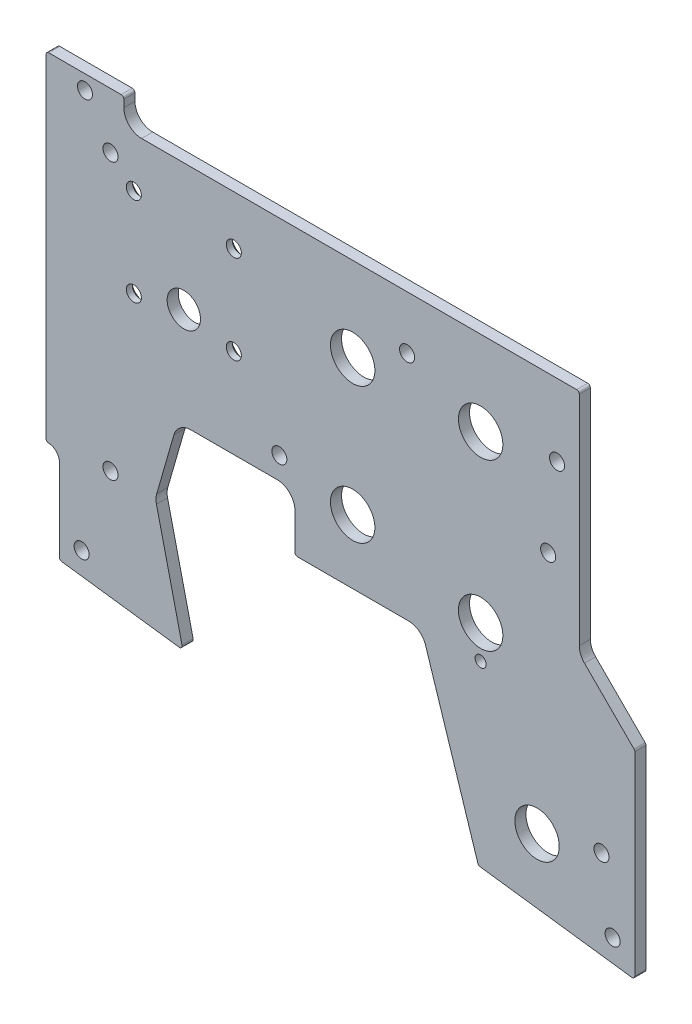
from build123d import *

# Parameters (mm, degrees)
BOSS_EXTRUDE1_DEPTH                       = 3.175
F_6_CLEARANCE_HOLE1_D                     = 4.3053
SKETCH4_R                                 = 6.35
SKETCH4_R_2                               = 1.5875
SKETCH4_R_3                               = 4.7625
CUT_EXTRUDE1_DEPTH                        = 218.405084842
CSK_FOR_6_FLAT_HEAD_MACHINE_SCREW_2_COUNT = 2
CSK_FOR_6_FLAT_HEAD_MACHINE_SCREW_2_PITCH = 28.575
CSK_FOR_6_FLAT_HEAD_MACHINE_SCREW_3_COUNT = 2
CSK_FOR_6_FLAT_HEAD_MACHINE_SCREW_3_PITCH = 38.232062788
CSK_FOR_6_FLAT_HEAD_MACHINE_SCREW_4_COUNT = 2
CSK_FOR_6_FLAT_HEAD_MACHINE_SCREW_4_PITCH = 25.4


with BuildPart() as part:
    # Sketch1 → Boss-Extrude1 (new body)
    with BuildSketch(Plane.XY):
        with BuildLine():
            Line((3.809986215, -91.884500325), (3.80998361, -115.403340545))
            ThreePointArc((3.80998361, -115.403340545), (3.999081622, -115.90576205), (4.472522544, -116.158821571))
            Line((4.472522544, -116.158821571), (38.023104274, -120.5758443))
            ThreePointArc((38.023104274, -120.5758443), (38.687459595, -120.33177166), (38.864463259, -119.646491316))
            Line((38.864463259, -119.646491316), (31.544635998, -88.413376307))
            ThreePointArc((31.544635998, -88.413376307), (31.412233483, -87.126289027), (31.609278422, -85.84750156))
            Line((31.609278422, -85.84750156), (36.533410401, -68.760772014))
            ThreePointArc((36.533410401, -68.760772014), (38.360231081, -66.108400459), (41.414754107, -65.0875))
            Line((41.414754107, -65.0875), (66.039990754, -65.0875))
            ThreePointArc((66.039990754, -65.0875), (69.632093202, -66.575397552), (71.119990754, -70.1675))
            Line((71.119990754, -70.1675), (71.119990754, -80.518))
            ThreePointArc((71.119990754, -80.518), (71.343175387, -81.056815367), (71.881990754, -81.28))
            Line((71.881990754, -81.28), (103.612235862, -81.28))
            ThreePointArc((103.612235862, -81.28), (106.604490402, -82.25478225), (108.448399818, -84.805034342))
            Line((108.448399818, -84.805034342), (123.423319929, -131.379161885))
            ThreePointArc((123.423319929, -131.379161885), (123.660593225, -131.731025839), (124.049283564, -131.901398021))
            Line((124.049283564, -131.901398021), (167.413526593, -137.610408921))
            ThreePointArc((167.413526593, -137.610408921), (168.015409063, -137.42782987), (168.274987552, -136.854927937))
            Line((168.274987552, -136.854927937), (168.274987552, -81.303553632))
            ThreePointArc((168.274987552, -81.303553632), (168.216983776, -81.011948907), (168.051802995, -80.764738341))
            Line((168.051802995, -80.764738341), (153.88788809, -66.600819412))
            ThreePointArc((153.88788809, -66.600819412), (152.786682817, -64.952748811), (152.399991049, -63.008717113))
            Line((152.399991049, -63.008717113), (152.399999892, -0.762021595))
            ThreePointArc((152.399999892, -0.762021595), (152.176815316, -0.223206231), (151.638, -2.1541e-05))
            Line((151.638, -2.1541e-05), (27.305, -3.804e-06))
            ThreePointArc((27.305, -3.804e-06), (23.712898123, 1.487894033), (22.22500087, 5.079996121))
            Line((22.22500087, 5.079996121), (22.225001755, 7.175496897))
            ThreePointArc((22.225001755, 7.175496897), (22.001816945, 7.7143128), (21.463001073, 7.937498421))
            Line((21.463001073, 7.937498421), (0.762001075, 7.937499892))
            ThreePointArc((0.762001075, 7.937499892), (0.223185691, 7.714315297), (1.021e-06, 7.175499945))
            Line((1.021e-06, 7.175499945), (-1.2342e-05, -87.949548922))
            ThreePointArc((-1.2342e-05, -87.949548922), (0.214550622, -88.479602508), (0.737406874, -88.711153328))
            ThreePointArc((0.737406874, -88.711153328), (2.915974038, -89.675944454), (3.809986215, -91.884500325))
        make_face()
    extrude(amount=-BOSS_EXTRUDE1_DEPTH)

    # #6 Clearance Hole1 (through all)
    with Locations(Plane(origin=(0, 0, -3.175), x_dir=(-1, 0, 0), z_dir=(0, 0, -1))):
        with Locations((-11.112500541, 3.81), (-18.414998872, -7.937503157), (-103.187497835, -15.240014658), (-143.510001128, -44.450020387), (-158.750001128, -111.125021649), (-18.414987678, -86.741003157), (-66.674991751, -58.7375), (-10.16, -110.502822935), (-146.049997068, -20.637520747), (-161.924987552, -130.483035149)):
            Hole(F_6_CLEARANCE_HOLE1_D / 2)

    # Sketch4 → Cut-Extrude1 (cut, through all)
    with BuildSketch(Plane(origin=(0, 0, -3.175), x_dir=(-1, 0, 0), z_dir=(0, 0, -1))):
        with Locations((-140.334987552, -115.57)):
            Circle(SKETCH4_R)
        with Locations((-124.205996572, -71.437521424)):
            Circle(SKETCH4_R)
        with Locations((-87.63, -62.992021649)):
            Circle(SKETCH4_R)
        with Locations((-87.63, -24.130021649)):
            Circle(SKETCH4_R)
        with Locations((-124.205996572, -24.130021649)):
            Circle(SKETCH4_R)
        with Locations((-124.205996572, -80.962521424)):
            Circle(SKETCH4_R_2)
        with Locations((-39.36999484, -36.322003157)):
            Circle(SKETCH4_R_3)
    extrude(amount=-CUT_EXTRUDE1_DEPTH, mode=Mode.SUBTRACT)

    # Sketch5 → CSK for #6 Flat Head Machine Screw (100)1 (revolve, cut)
    with BuildSketch(Plane(origin=(53.65749484, -14.097003157, -3.175), x_dir=(0, 1, 0), z_dir=(1, 0, 0))):
        Polygon((0, 0), (0, 3.175), (2.15265, 3.175), (2.15265, 1.420893136), (3.8460045, 0), align=None)
    csk_for_6_flat_head_machine_screw_100 = revolve(axis=Axis((53.65749484, -14.097003157, -9.525), (0, 0, 1)), mode=Mode.SUBTRACT)

    # CSK for _6 Flat Head Machine Screw _ 2: CSK for #6 Flat Head Machine Screw (100)1 ×2
    with Locations(*[(-i * CSK_FOR_6_FLAT_HEAD_MACHINE_SCREW_2_PITCH, 0, 0) for i in range(1, CSK_FOR_6_FLAT_HEAD_MACHINE_SCREW_2_COUNT)]):
        add(csk_for_6_flat_head_machine_screw_100, mode=Mode.SUBTRACT)

    # CSK for _6 Flat Head Machine Screw _ 3: CSK for #6 Flat Head Machine Screw (100)1 ×2
    with Locations(*[Vector(-0.7474093186836602, -0.6643638388299193, 0) * (i * CSK_FOR_6_FLAT_HEAD_MACHINE_SCREW_3_PITCH) for i in range(1, CSK_FOR_6_FLAT_HEAD_MACHINE_SCREW_3_COUNT)]):
        add(csk_for_6_flat_head_machine_screw_100, mode=Mode.SUBTRACT)

    # CSK for _6 Flat Head Machine Screw _ 4: CSK for #6 Flat Head Machine Screw (100)1 ×2
    with Locations(*[(0, -i * CSK_FOR_6_FLAT_HEAD_MACHINE_SCREW_4_PITCH, 0) for i in range(1, CSK_FOR_6_FLAT_HEAD_MACHINE_SCREW_4_COUNT)]):
        add(csk_for_6_flat_head_machine_screw_100, mode=Mode.SUBTRACT)


solid = part.part
